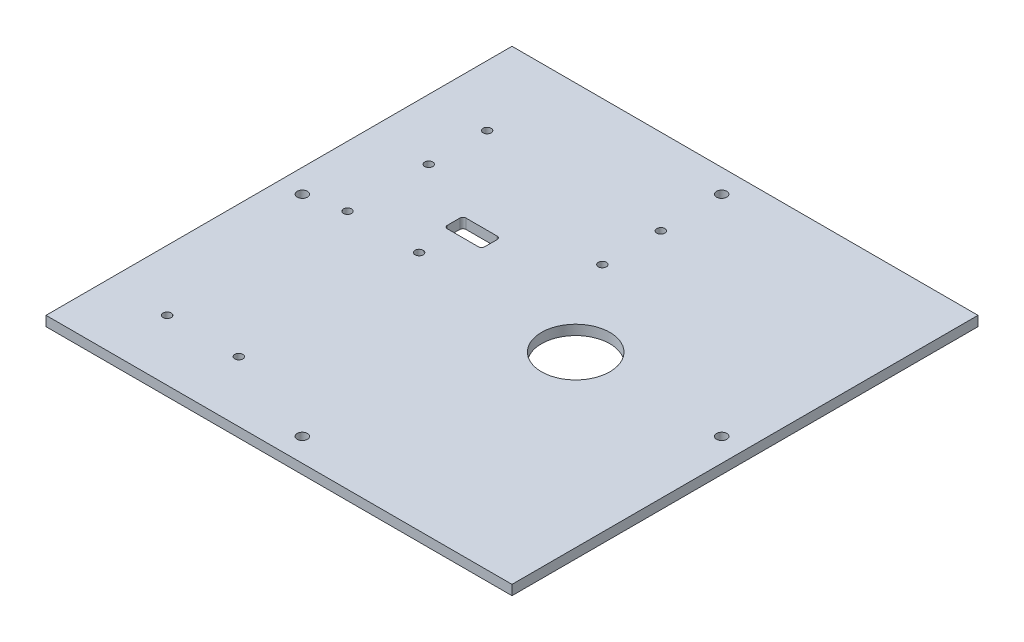
from build123d import *

# Parameters (mm, degrees)
SKETCH1_W           = 150
SKETCH1_H           = 150
SKETCH1_R           = 1.65
SKETCH1_R_2         = 1.3
SKETCH1_R_3         = 11
BOSS_EXTRUDE1_DEPTH = 3.175


with BuildPart() as part:
    # Sketch1 → Boss-Extrude1 (new body)
    with BuildSketch(Plane(origin=(0, 0, 0), x_dir=(1, 0, 0), z_dir=(0, 1, 0))):
        with Locations((4.465710009, 0)):
            Rectangle(SKETCH1_W, SKETCH1_H)
        with Locations((-63.034289991, 0)):
            Circle(SKETCH1_R, mode=Mode.SUBTRACT)
        with Locations((4.465710009, 67.5)):
            Circle(SKETCH1_R, mode=Mode.SUBTRACT)
        with Locations((71.965710009, 0)):
            Circle(SKETCH1_R, mode=Mode.SUBTRACT)
        with Locations((4.465710009, -67.5)):
            Circle(SKETCH1_R, mode=Mode.SUBTRACT)
        with Locations((-51.034289991, -55.5)):
            Circle(SKETCH1_R_2, mode=Mode.SUBTRACT)
        with Locations((-27.984289991, -55.5)):
            Circle(SKETCH1_R_2, mode=Mode.SUBTRACT)
        with Locations((-27.984289991, 2.55)):
            Circle(SKETCH1_R_2, mode=Mode.SUBTRACT)
        with Locations((-51.034289991, 2.55)):
            Circle(SKETCH1_R_2, mode=Mode.SUBTRACT)
        with Locations((4.865710009, 47.5)):
            Circle(SKETCH1_R_2, mode=Mode.SUBTRACT)
        with Locations((4.865710009, 28.7)):
            Circle(SKETCH1_R_2, mode=Mode.SUBTRACT)
        with Locations((-51.034289991, 47.5)):
            Circle(SKETCH1_R_2, mode=Mode.SUBTRACT)
        with Locations((-51.034289991, 28.7)):
            Circle(SKETCH1_R_2, mode=Mode.SUBTRACT)
        with Locations((24.965710009, 0)):
            Circle(SKETCH1_R_3, mode=Mode.SUBTRACT)
        with BuildLine():
            Line((-30.034289991, 19.7), (-20.034289991, 19.7))
            ThreePointArc((-20.034289991, 19.7), (-19.32718321, 19.407106781), (-19.034289991, 18.7))
            Line((-19.034289991, 18.7), (-19.034289991, 14.7))
            ThreePointArc((-19.034289991, 14.7), (-19.32718321, 13.992893219), (-20.034289991, 13.7))
            Line((-20.034289991, 13.7), (-30.034289991, 13.7))
            ThreePointArc((-30.034289991, 13.7), (-30.741396772, 13.992893219), (-31.034289991, 14.7))
            Line((-31.034289991, 14.7), (-31.034289991, 18.7))
            ThreePointArc((-31.034289991, 18.7), (-30.741396772, 19.407106781), (-30.034289991, 19.7))
        make_face(mode=Mode.SUBTRACT)
    extrude(amount=BOSS_EXTRUDE1_DEPTH)


solid = part.part
